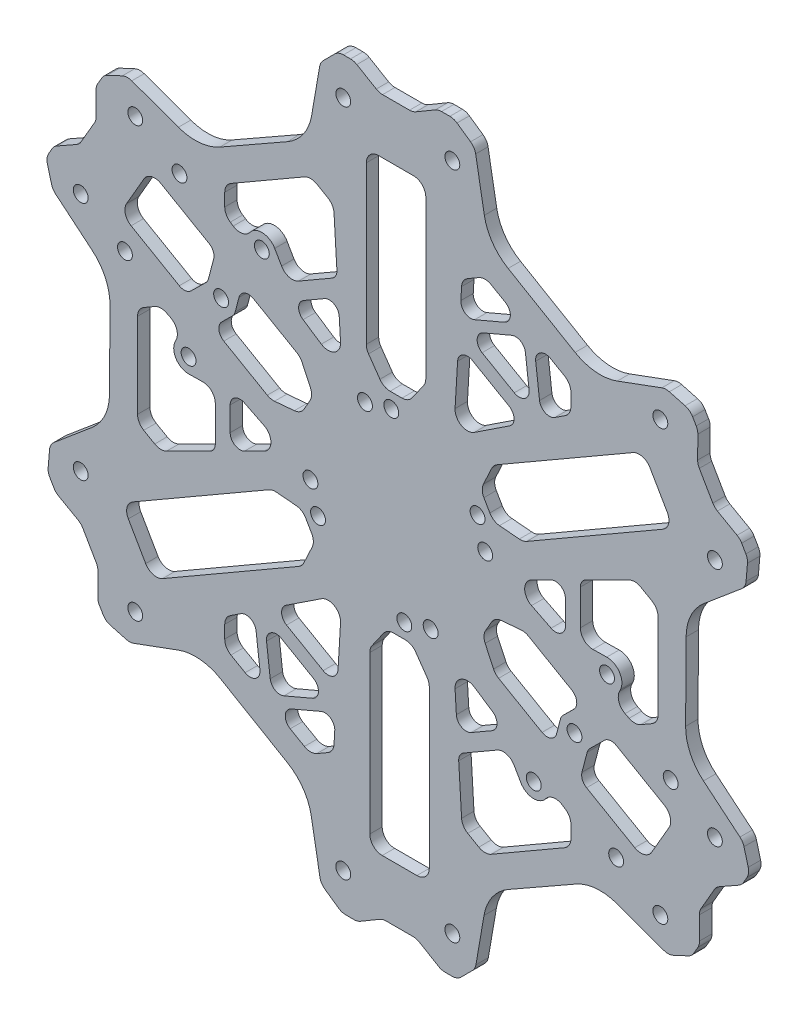
from build123d import *
from OCP.BRepFilletAPI import BRepFilletAPI_MakeChamfer

# Parameters (mm, degrees)
BOSS_EXTRUDE1_DEPTH      = 2.5
FILLET2_R                = 10
CHAMFER1_SIZE            = 3
CHAMFER1_SIZE2           = 3.705314063714124
CHAMFER1_SIZE2_2         = 3.6784582110804016
CHAMFER1_SIZE2_3         = 3.7053140637145114
CHAMFER1_SIZE2_4         = 3.6784582110804007
CHAMFER1_SIZE2_5         = 3.678458211080398
CHAMFER1_SIZE2_6         = 3.7053140637145163
CHAMFER1_SIZE2_7         = 3.678458211080397
CHAMFER1_SIZE2_8         = 3.7053140637145203
CHAMFER1_SIZE2_9         = 3.7053140637145243
CHAMFER1_SIZE2_10        = 3.6784582110807733
CUT_EXTRUDE2_DEPTH       = 2.5
CIRPATTERN1_COUNT        = 6
CUT_EXTRUDE3_DEPTH       = 9.500000000000002
FILLET4_R                = 2.5
CIRPATTERN2_COUNT        = 6
FILLET4_OF_CIRPATTERN2_R = 2.5
CUT_EXTRUDE4_DEPTH       = 9.500000000000002
CIRPATTERN3_COUNT        = 6
FILLET5_R                = 2.5
CUT_EXTRUDE5_DEPTH       = 10
FILLET6_R                = 2.5
CIRPATTERN4_COUNT        = 6
FILLET6_OF_CIRPATTERN4_R = 2.5
BOSS_EXTRUDE2_DEPTH      = 2.5
FILLET7_R                = 2
FILLET8_R                = 2
BOSS_EXTRUDE3_DEPTH      = 2.5
FILLET9_R                = 2
BOSS_EXTRUDE5_DEPTH      = 2.5
FILLET11_R               = 2
CUT_EXTRUDE6_DEPTH       = 2.5
FILLET12_R               = 2
CIRPATTERN8_COUNT        = 2
CIRPATTERN8_ANGLE        = 60.00000000000014
BOSS_EXTRUDE6_DEPTH      = 2.5
FILLET13_R               = 2
SKETCH14_R               = 1.5000000000000042
CUT_EXTRUDE7_DEPTH       = 2.5
BOSS_EXTRUDE7_DEPTH      = 2.5
FILLET14_R               = 2
FILLET15_R               = 2
SKETCH16_R               = 1.5000000000000042
CUT_EXTRUDE8_DEPTH       = 2.5
FILLET16_R               = 2
FILLET17_R               = 2
BOSS_EXTRUDE8_START      = -2.5
BOSS_EXTRUDE8_OUTLINE_R  = 1.5
BOSS_EXTRUDE8_DEPTH      = 2.5
FILLET18_R               = 2.5
FILLET19_R               = 2.5
SKETCH18_R               = 1.4999999999999958
SKETCH18_R_2             = 1.5000000000000007
SKETCH18_R_3             = 1.5000000000000042
SKETCH18_R_4             = 1.5000000000000009
CUT_EXTRUDE9_DEPTH       = 10.500000000000002


with BuildPart() as part:
    # Sketch1 → Boss-Extrude1 (new body)
    with BuildSketch(Plane.XY):
        Polygon((15.000000000000654, 75.0000000000022), (-15, 75), (-18.188921512053522, 56.503692810403834), (-39.91361886639036, 44.132859173883205), (-57.451905283832424, 50.490381056766886), (-72.45190528383297, 24.509618943233235), (-58.0280941374637, 12.499778308317667), (-58.176986619414194, -12.499778308326903), (-72.45190528382821, -24.509618943237626), (-57.45190528383172, -50.49038105676858), (-39.839172625403684, -44.00391450208413), (-18.26336775301738, -56.632637482208075), (-14.99999999998908, -75.0000000000026), (15.000000000004292, -75.00000000000004), (18.188921512066422, -56.50369281039981), (39.91361886640323, -44.132859173879176), (57.45190528384555, -50.490381056763), (72.451905283835, -24.50961894322983), (58.02809413747655, -12.499778308313674), (58.176986619427055, 12.4997783083309), (72.45190528384109, 24.50961894324161), (57.45190528383191, 50.49038105676833), (39.83917262541656, 44.00391450208814), (18.26336775303026, 56.63263748221209), align=None)
    extrude(amount=BOSS_EXTRUDE1_DEPTH)

    # Fillet2
    fillet2_edges = [part.edges().sort_by_distance(p)[0] for p in [
        (18.26336775303026, 56.63263748221209, 1.25),
        (39.83917262541656, 44.00391450208814, 1.25),
        (58.176986619427055, 12.4997783083309, 1.25),
        (58.02809413747655, -12.499778308313676, 1.25),
        (39.91361886640323, -44.132859173879176, 1.25),
        (18.188921512066422, -56.50369281039981, 1.25),
        (-18.26336775301738, -56.632637482208075, 1.25),
        (-39.839172625403684, -44.00391450208413, 1.25),
        (-58.176986619414194, -12.499778308326903, 1.25),
        (-58.0280941374637, 12.499778308317666, 1.25),
        (-39.91361886639036, 44.132859173883205, 1.25),
        (-18.188921512053522, 56.503692810403834, 1.25),
    ]]
    fillet(fillet2_edges, radius=FILLET2_R)

    # Chamfer1: one chamfer whose edges measure the first distance from different faces: ONE call of the kernel's chamfer builder (chamfer() names one face for all edges)
    chamfer1_edges_1 = [part.edges().sort_by_distance(p)[0] for p in [
        (15.000000000001307, 75.0000000000044, 1.25),
    ]]
    chamfer1_side_1 = [part.faces().sort_by_distance(p)[0] for p in [
        (16.22768101949323, 68.09018656562225, 1.25),
    ]]
    chamfer1_edges_2 = [part.edges().sort_by_distance(p)[0] for p in [
        (57.451905283833156, 50.49038105677075, 1.25),
    ]]
    chamfer1_side_2 = [part.faces().sort_by_distance(p)[0] for p in [
        (64.95190528383151, 37.500000000002466, 1.25),
    ]]
    chamfer1_edges_3 = [part.edges().sort_by_distance(p)[0] for p in [
        (72.45190528383667, 24.50961894323811, 1.25),
    ]]
    chamfer1_side_3 = [part.faces().sort_by_distance(p)[0] for p in [
        (67.0816718239975, 19.99150927542486, 1.25),
    ]]
    chamfer1_edges_4 = [part.edges().sort_by_distance(p)[0] for p in [
        (72.45190528383792, -24.50961894322733, 1.25),
    ]]
    chamfer1_side_4 = [part.faces().sort_by_distance(p)[0] for p in [
        (64.95190528383648, -37.49999999999385, 1.25),
    ]]
    chamfer1_edges_5 = [part.edges().sort_by_distance(p)[0] for p in [
        (57.45190528384011, -50.49038105676328, 1.25),
    ]]
    chamfer1_side_5 = [part.faces().sort_by_distance(p)[0] for p in [
        (50.853990804510666, -48.09867729019373, 1.25),
    ]]
    chamfer1_edges_6 = [part.edges().sort_by_distance(p)[0] for p in [
        (15.00000000000858, -74.99999999999802, 1.25),
    ]]
    chamfer1_side_6 = [part.faces().sort_by_distance(p)[0] for p in [
        (7.93021e-12, -75.00000000000004, 1.25),
    ]]
    chamfer1_edges_7 = [part.edges().sort_by_distance(p)[0] for p in [
        (-14.99999999999272, -75.00000000000132, 1.25),
    ]]
    chamfer1_side_7 = [part.faces().sort_by_distance(p)[0] for p in [
        (-16.227681019480332, -68.09018656561831, 1.25),
    ]]
    chamfer1_edges_8 = [part.edges().sort_by_distance(p)[0] for p in [
        (-57.45190528382662, -50.49038105676887, 1.25),
    ]]
    chamfer1_side_8 = [part.faces().sort_by_distance(p)[0] for p in [
        (-64.95190528383064, -37.500000000003865, 1.25),
    ]]
    chamfer1_edges_9 = [part.edges().sort_by_distance(p)[0] for p in [
        (-72.45190528383013, -24.509618943236237, 1.25),
    ]]
    chamfer1_side_9 = [part.faces().sort_by_distance(p)[0] for p in [
        (-67.081671823987, -19.991509275422867, 1.25),
    ]]
    chamfer1_edges_10 = [part.edges().sort_by_distance(p)[0] for p in [
        (-72.45190528383048, 24.509618943231025, 1.25),
    ]]
    chamfer1_side_10 = [part.faces().sort_by_distance(p)[0] for p in [
        (-64.95190528383297, 37.49999999999983, 1.25),
    ]]
    chamfer1_edges_11 = [part.edges().sort_by_distance(p)[0] for p in [
        (-57.45190528383253, 50.49038105676695, 1.25),
    ]]
    chamfer1_side_11 = [part.faces().sort_by_distance(p)[0] for p in [
        (-50.853990804500064, 48.098677290198545, 1.25),
    ]]
    chamfer1_edges_12 = [part.edges().sort_by_distance(p)[0] for p in [
        (-15, 75, 1.25),
    ]]
    chamfer1_side_12 = [part.faces().sort_by_distance(p)[0] for p in [
        (6.5387e-13, 75.0000000000011, 1.25),
    ]]
    chamfer1 = BRepFilletAPI_MakeChamfer(part.part.solid().wrapped)
    for e in chamfer1_edges_1:
        chamfer1.Add(CHAMFER1_SIZE, CHAMFER1_SIZE2, e.wrapped, chamfer1_side_1[0].wrapped)  # the first distance lies on this face
    for e in chamfer1_edges_2:
        chamfer1.Add(CHAMFER1_SIZE, CHAMFER1_SIZE2_2, e.wrapped, chamfer1_side_2[0].wrapped)  # the first distance lies on this face
    for e in chamfer1_edges_3:
        chamfer1.Add(CHAMFER1_SIZE, CHAMFER1_SIZE2_3, e.wrapped, chamfer1_side_3[0].wrapped)  # the first distance lies on this face
    for e in chamfer1_edges_4:
        chamfer1.Add(CHAMFER1_SIZE, CHAMFER1_SIZE2_4, e.wrapped, chamfer1_side_4[0].wrapped)  # the first distance lies on this face
    for e in chamfer1_edges_5:
        chamfer1.Add(CHAMFER1_SIZE, CHAMFER1_SIZE2_3, e.wrapped, chamfer1_side_5[0].wrapped)  # the first distance lies on this face
    for e in chamfer1_edges_6:
        chamfer1.Add(CHAMFER1_SIZE, CHAMFER1_SIZE2_5, e.wrapped, chamfer1_side_6[0].wrapped)  # the first distance lies on this face
    for e in chamfer1_edges_7:
        chamfer1.Add(CHAMFER1_SIZE, CHAMFER1_SIZE2_6, e.wrapped, chamfer1_side_7[0].wrapped)  # the first distance lies on this face
    for e in chamfer1_edges_8:
        chamfer1.Add(CHAMFER1_SIZE, CHAMFER1_SIZE2_7, e.wrapped, chamfer1_side_8[0].wrapped)  # the first distance lies on this face
    for e in chamfer1_edges_9:
        chamfer1.Add(CHAMFER1_SIZE, CHAMFER1_SIZE2_8, e.wrapped, chamfer1_side_9[0].wrapped)  # the first distance lies on this face
    for e in chamfer1_edges_10:
        chamfer1.Add(CHAMFER1_SIZE, CHAMFER1_SIZE2_7, e.wrapped, chamfer1_side_10[0].wrapped)  # the first distance lies on this face
    for e in chamfer1_edges_11:
        chamfer1.Add(CHAMFER1_SIZE, CHAMFER1_SIZE2_9, e.wrapped, chamfer1_side_11[0].wrapped)  # the first distance lies on this face
    for e in chamfer1_edges_12:
        chamfer1.Add(CHAMFER1_SIZE, CHAMFER1_SIZE2_10, e.wrapped, chamfer1_side_12[0].wrapped)  # the first distance lies on this face
    add(Compound.cast(chamfer1.Shape()), mode=Mode.REPLACE)

    # Sketch2 → Cut-Extrude2 (cut)
    with BuildSketch(Plane.XY):
        with BuildLine():
            ThreePointArc((12.500000000000004, 67.5), (11.000000000000004, 69), (9.500000000000004, 67.5))
            Line((9.500000000000004, 67.5), (12.500000000000004, 67.5))
        make_face()
        with BuildLine():
            Line((12.500000000000004, 67.5), (9.500000000000004, 67.5))
            ThreePointArc((9.500000000000004, 67.5), (11.000000000000004, 66), (12.500000000000004, 67.5))
        make_face()
        with BuildLine():
            ThreePointArc((-9.5, 67.5), (-11, 69), (-12.5, 67.5))
            Line((-12.5, 67.5), (-11, 67.5))
            Line((-11, 67.5), (-9.5, 67.5))
        make_face()
        with BuildLine():
            Line((-11, 67.5), (-12.5, 67.5))
            ThreePointArc((-12.5, 67.5), (-11, 66), (-9.5, 67.5))
            Line((-9.5, 67.5), (-11, 67.5))
        make_face()
    cut_extrude2 = extrude(amount=CUT_EXTRUDE2_DEPTH, mode=Mode.SUBTRACT)

    # CirPattern1: Cut-Extrude2 ×6 about axis
    cirpattern1_axis = Axis((-7.962e-14, -2.3e-15, 0), (0, 0, 1))
    for i in range(1, CIRPATTERN1_COUNT):
        add(cut_extrude2.rotate(cirpattern1_axis, i * 360 / CIRPATTERN1_COUNT), mode=Mode.SUBTRACT)

    # Sketch4 → Cut-Extrude3 (cut)
    with BuildSketch(Plane(origin=(0, 0, 0), x_dir=(-1, 0, 0), z_dir=(0, 0, -1))):
        Polygon((-34.91025403784441, 35.107349850060594), (-11.250000000000018, 19.485571585149888), (-12.948729810778094, 47.78684177437182), (-17.589745962155636, 50.46633369868304), (-34.9102540378444, 40.46633369868304), align=None)
    cut_extrude3 = extrude(amount=-CUT_EXTRUDE3_DEPTH, mode=Mode.SUBTRACT)

    # Fillet4
    fillet4_edges = [part.edges().sort_by_distance(p)[0] for p in [
        (11.250000000000018, 19.485571585149884, 1.25),
    ]]
    fillet(fillet4_edges, radius=FILLET4_R)

    # CirPattern2: Cut-Extrude3 ×6 about axis
    cirpattern2_axis = Axis((7.66e-15, -5.97e-15, 0), (0, 0, 1))
    for i in range(1, CIRPATTERN2_COUNT):
        add(cut_extrude3.rotate(cirpattern2_axis, i * 360 / CIRPATTERN2_COUNT), mode=Mode.SUBTRACT)

    # Fillet4 of CirPattern2
    fillet4_of_cirpattern2_edges = [part.edges().sort_by_distance(p)[0] for p in [
        (-11.250000000000002, 19.48557158514988, 1.25),
        (-22.500000000000014, -3.16e-15, 1.25),
        (-11.250000000000004, -19.485571585149895, 1.25),
        (11.250000000000009, -19.485571585149902, 1.25),
        (22.500000000000032, -1.68e-15, 1.25),
    ]]
    fillet(fillet4_of_cirpattern2_edges, radius=FILLET4_OF_CIRPATTERN2_R)

    # Sketch5 → Cut-Extrude4 (cut)
    with BuildSketch(Plane(origin=(0, 0, 0), x_dir=(-1, 0, 0), z_dir=(0, 0, -1))):
        Polygon((8.85265703185725, 75), (-8.14734296814275, 75), (-3.0473429681427646, 72), (3.7526570318572663, 72), align=None)
    cut_extrude4 = extrude(amount=-CUT_EXTRUDE4_DEPTH, mode=Mode.SUBTRACT)

    # CirPattern3: Cut-Extrude4 ×6 about axis
    cirpattern3_axis = Axis((-2.68e-15, -2.54e-15, 0), (0, 0, 1))
    for i in range(1, CIRPATTERN3_COUNT):
        add(cut_extrude4.rotate(cirpattern3_axis, i * 360 / CIRPATTERN3_COUNT), mode=Mode.SUBTRACT)

    # Fillet5
    fillet5_edges = [part.edges().sort_by_distance(p)[0] for p in [
        (54.00009456393864, 49.21913852888492, 1.25),
        (70.59924825197515, 27.71851505141083, 1.25),
        (58.95190528383004, 47.89230484541825, 1.25),
        (70.15628897958496, 22.578260410057936, 1.25),
        (69.62507160037215, -22.155884434685095, 1.25),
        (59.30456231569408, -47.28148494858332, 1.25),
        (70.95190528383884, -27.10769515457649, 1.25),
        (54.6314915781665, -49.46799828652797, 1.25),
        (15.624977036436885, -71.37502296357532, 1.25),
        (-11.294685936275018, -75.00000000000004, 1.25),
        (12.000000000012172, -75.00000000000004, 1.25),
        (-15.524797401412394, -72.0462586965918, 1.25),
        (-54.00009456393825, -49.219138528885516, 1.25),
        (-70.59924825197245, -27.718515051415423, 1.25),
        (-58.951905283829646, -47.89230484541885, 1.25),
        (-70.15628897958226, -22.578260410062516, 1.25),
        (-69.62507160036638, 22.15588443469498, 1.25),
        (-59.30456231568991, 47.28148494859043, 1.25),
        (-70.95190528383307, 27.10769515458637, 1.25),
        (-54.63149157816232, 49.467998286535106, 1.25),
        (-15.624977036424776, 71.3750229635749, 1.25),
        (11.294685936288626, 75.00000000000193, 1.25),
        (-12.000000000000004, 75.00000000000021, 1.25),
        (15.52479740142561, 72.04625869659397, 1.25),
        (34.9102540378444, 40.46633369868304, 1.25),
        (17.589745962155636, 50.46633369868304, 1.25),
        (12.9487298107781, 47.78684177437182, 1.25),
        (34.91025403784441, 35.1073498500606, 1.25),
        (-17.589745962155604, 50.46633369868304, 1.25),
        (-34.91025403784438, 40.46633369868305, 1.25),
        (-34.91025403784438, 35.10734985006061, 1.25),
        (-12.948729810778074, 47.78684177437183, 1.25),
        (-52.50000000000001, 10.000000000000009, 1.25),
        (-52.500000000000014, -9.99999999999999, 1.25),
        (-47.85898384862248, -12.679491924311213, 1.25),
        (-47.85898384862248, 12.679491924311227, 1.25),
        (-34.910254037844396, -40.466333698683044, 1.25),
        (-17.58974596215563, -50.46633369868305, 1.25),
        (-12.94872981077809, -47.78684177437184, 1.25),
        (-34.9102540378444, -35.10734985006061, 1.25),
        (17.589745962155604, -50.46633369868306, 1.25),
        (34.910254037844375, -40.46633369868307, 1.25),
        (34.91025403784438, -35.10734985006063, 1.25),
        (12.94872981077807, -47.78684177437184, 1.25),
        (52.50000000000002, -10, 1.25),
        (52.50000000000002, 9.999999999999996, 1.25),
        (47.85898384862249, 12.679491924311217, 1.25),
        (47.85898384862249, -12.679491924311225, 1.25),
        (3.0473429681427646, 72, 1.25),
        (8.147342968142752, 75, 1.25),
        (-8.85265703185725, 75, 1.25),
        (-3.7526570318572654, 72, 1.25),
        (63.87750055655096, 33.36092357554449, 1.25),
        (69.02557676790428, 30.44419401624387, 1.25),
        (60.525576767904276, 45.166625880579325, 1.25),
        (60.47750055655094, 39.249896321278705, 1.25),
        (60.83015758840818, -38.639076424455546, 1.25),
        (60.87823379976149, -44.55580598375617, 1.25),
        (69.3782337997615, -29.833374119420718, 1.25),
        (64.2301575884082, -32.75010367872134, 1.25),
        (-3.047342968142779, -72, 1.25),
        (-8.147342968142766, -75, 1.25),
        (8.852657031857236, -75, 1.25),
        (3.752657031857251, -72, 1.25),
        (-63.87750055655097, -33.360923575544476, 1.25),
        (-69.02557676790427, -30.444194016243852, 1.25),
        (-60.52557676790428, -45.16662588057931, 1.25),
        (-60.47750055655096, -39.24989632127869, 1.25),
        (-60.83015758840819, 38.63907642445552, 1.25),
        (-60.878233799761524, 44.55580598375614, 1.25),
        (-69.37823379976153, 29.833374119420682, 1.25),
        (-64.2301575884082, 32.7501036787213, 1.25),
    ]]
    fillet(fillet5_edges, radius=FILLET5_R)

    # Sketch6 → Cut-Extrude5 (cut)
    with BuildSketch(Plane(origin=(0, 0, 0), x_dir=(-1, 0, 0), z_dir=(0, 0, -1))):
        Polygon((-49.606824953606406, 35.97593023543246), (-52.606824953606456, 30.779777812725857), (-17.965808802229105, 10.77977781272551), (-16.715808802229084, 12.944841322186596), (-19.295935821151218, 18.475930235432166), align=None)
        Polygon((-17.965808802229105, 10.77977781272551), (-52.60682495360646, 30.779777812725865), (-55.606824953606505, 25.583625390019254), (-25.295935821151314, 8.083625390018952), (-19.215808802229127, 8.614714303264426), align=None)
    cut_extrude5 = extrude(amount=-CUT_EXTRUDE5_DEPTH, mode=Mode.SUBTRACT)

    # Fillet6
    fillet6_edges = [part.edges().sort_by_distance(p)[0] for p in [
        (16.715808802229084, 12.944841322186596, 1.25),
        (19.215808802229127, 8.614714303264426, 1.25),
        (25.295935821151314, 8.083625390018952, 1.25),
        (55.606824953606505, 25.583625390019254, 1.25),
        (49.606824953606406, 35.97593023543246, 1.25),
        (19.295935821151218, 18.475930235432166, 1.25),
    ]]
    fillet(fillet6_edges, radius=FILLET6_R)

    # CirPattern4: Cut-Extrude5 ×6 about axis
    cirpattern4_axis = Axis((1.436e-14, -2.486e-14, 0), (0, 0, 1))
    for i in range(1, CIRPATTERN4_COUNT):
        add(cut_extrude5.rotate(cirpattern4_axis, i * 360 / CIRPATTERN4_COUNT), mode=Mode.SUBTRACT)

    # Fillet6 of CirPattern4
    fillet6_of_cirpattern4_edges = [part.edges().sort_by_distance(p)[0] for p in [
        (-2.8526570318576034, 20.94873572862719, 1.25),
        (2.1473429681423974, 20.948735728627238, 1.25),
        (5.647342968142343, 25.948735728627263, 1.25),
        (5.647342968142006, 60.94873572862728, 1.25),
        (-6.352657031857991, 60.948735728627156, 1.25),
        (-6.352657031857662, 25.94873572862716, 1.25),
        (-19.568465834086673, 8.003894406440573, 1.25),
        (-17.068465834086716, 12.334021425362792, 1.25),
        (-19.648592853008957, 17.86511033860829, 1.25),
        (-49.959481985464485, 35.365110338608, 1.25),
        (-55.95948198546438, 24.972805493194684, 1.25),
        (-25.648592853008868, 7.472805493194969, 1.25),
        (-16.715808802229056, -12.944841322186644, 1.25),
        (-19.2158088022291, -8.614714303264474, 1.25),
        (-25.295935821151286, -8.083625390018998, 1.25),
        (-55.60682495360648, -25.583625390019296, 1.25),
        (-49.606824953606385, -35.9759302354325, 1.25),
        (-19.295935821151193, -18.475930235432212, 1.25),
        (2.8526570318576234, -20.94873572862724, 1.25),
        (-2.1473429681423775, -20.948735728627288, 1.25),
        (-5.647342968142324, -25.94873572862731, 1.25),
        (-5.647342968142002, -60.94873572862732, 1.25),
        (6.352657031857998, -60.948735728627206, 1.25),
        (6.35265703185768, -25.94873572862721, 1.25),
        (19.568465834086705, -8.003894406440615, 1.25),
        (17.068465834086748, -12.334021425362835, 1.25),
        (19.648592853008992, -17.865110338608336, 1.25),
        (49.95948198546453, -35.36511033860804, 1.25),
        (55.95948198546442, -24.972805493194716, 1.25),
        (25.6485928530089, -7.472805493195013, 1.25),
    ]]
    fillet(fillet6_of_cirpattern4_edges, radius=FILLET6_OF_CIRPATTERN4_R)

    # Sketch8 → Boss-Extrude2 (add)
    with BuildSketch(Plane(origin=(0, 0, 0), x_dir=(-1, 0, 0), z_dir=(0, 0, -1))):
        Polygon((-18.75000000000003, 32.475952641916464), (-20.250000000000036, 35.074028853269795), (-26.961696879329438, 31.199028853269784), (-27.111215932167767, 29.95800344948535), (-25.24519052838331, 28.725952641916464), align=None)
        Polygon((-13.538303120670637, 38.949028853269795), (-20.250000000000036, 35.074028853269795), (-18.75000000000003, 32.475952641916464), (-12.254809471616733, 36.225952641916464), (-12.388784067832296, 38.45800344948536), align=None)
        Polygon((-26.961696879329438, 31.199028853269784), (-28.044228634059984, 30.574028853269784), (-27.111215932167763, 29.95800344948535), align=None)
        Polygon((-12.388784067832296, 38.45800344948536), (-12.455771365940077, 39.5740288532698), (-13.538303120670637, 38.949028853269795), align=None)
        Polygon((-28.044228634059984, 30.574028853269784), (-26.250000000000014, 45.46633369868302), (-12.455771365940079, 39.5740288532698), (-12.522758664047858, 40.690054257054236), (-27.08333333333335, 46.90970937165709), (-28.977241335952208, 31.19005425705423), align=None)
        Polygon((-12.455771365940079, 39.5740288532698), (-26.250000000000014, 45.46633369868302), (-25.416666666666686, 44.02295802570897), (-13.538303120670628, 38.949028853269795), align=None)
        Polygon((-25.416666666666686, 44.02295802570897), (-26.250000000000014, 45.46633369868302), (-28.044228634059984, 30.574028853269784), (-26.961696879329438, 31.199028853269784), align=None)
    extrude(amount=-BOSS_EXTRUDE2_DEPTH)

    # Fillet7
    fillet7_edges = [part.edges().sort_by_distance(p)[0] for p in [
        (25.16746824526949, 46.09133369868303, 1.25),
        (28.977241335952208, 31.19005425705423, 1.25),
        (25.416666666666686, 44.02295802570897, 1.25),
        (26.961696879329438, 31.19902885326978, 1.25),
        (12.522758664047856, 40.690054257054236, 1.25),
        (27.332531754730567, 44.84133369868303, 1.25),
        (13.538303120670633, 38.949028853269795, 1.25),
    ]]
    fillet(fillet7_edges, radius=FILLET7_R)

    # Fillet8
    fillet8_edges = [part.edges().sort_by_distance(p)[0] for p in [
        (12.254809471616733, 36.225952641916464, 1.25),
        (25.24519052838331, 28.725952641916464, 1.25),
    ]]
    fillet(fillet8_edges, radius=FILLET8_R)

    # Sketch9 → Boss-Extrude3 (add)
    with BuildSketch(Plane(origin=(0, 0, 0), x_dir=(-1, 0, 0), z_dir=(0, 0, -1))):
        Polygon((13.538303120670639, -38.94902885326981), (20.25000000000004, -35.07402885326981), (18.75000000000004, -32.47595264191649), (12.254809471616733, -36.2259526419165), (12.388784067832296, -38.45800344948537), align=None)
        Polygon((18.75000000000004, -32.47595264191649), (20.250000000000043, -35.07402885326981), (26.961696879329452, -31.199028853269798), (27.111215932167784, -29.958003449485364), (25.245190528383326, -28.725952641916475), align=None)
        Polygon((12.388784067832296, -38.45800344948537), (12.455771365940077, -39.574028853269816), (13.538303120670639, -38.94902885326981), align=None)
        Polygon((28.044228634060005, -30.574028853269795), (26.250000000000014, -45.46633369868302), (12.455771365940079, -39.574028853269816), (12.522758664047858, -40.69005425705426), (27.083333333333343, -46.90970937165709), (28.97724133595222, -31.19005425705424), align=None)
        Polygon((12.455771365940079, -39.574028853269816), (26.250000000000014, -45.46633369868302), (25.416666666666686, -44.02295802570897), (13.538303120670639, -38.94902885326981), align=None)
        Polygon((25.416666666666686, -44.02295802570897), (26.250000000000014, -45.46633369868302), (28.044228634060005, -30.574028853269795), (26.961696879329452, -31.199028853269798), align=None)
        Polygon((26.961696879329452, -31.199028853269798), (28.044228634060005, -30.574028853269795), (27.11121593216778, -29.95800344948536), align=None)
    extrude(amount=-BOSS_EXTRUDE3_DEPTH)

    # Fillet9
    fillet9_edges = [part.edges().sort_by_distance(p)[0] for p in [
        (-27.33253175473056, -44.84133369868306, 1.25),
        (-28.977241335952215, -31.19005425705424, 1.25),
        (-12.254809471616735, -36.2259526419165, 1.25),
        (-25.245190528383322, -28.725952641916486, 1.25),
        (-25.416666666666686, -44.02295802570897, 1.25),
        (-26.961696879329452, -31.199028853269795, 1.25),
        (-13.538303120670639, -38.94902885326981, 1.25),
        (-25.167468245269486, -46.091333698683044, 1.25),
    ]]
    fillet(fillet9_edges, radius=FILLET9_R)

    # Sketch10 → Boss-Extrude5 (add)
    with BuildSketch(Plane(origin=(0, 0, 0), x_dir=(-1, 0, 0), z_dir=(0, 0, -1))):
        Polygon((-33.814000395174794, -9.504e-14), (-33.814000395174794, 2.5675666915968423), (-36.321554050438905, 6.9107770252193355), (-36.81400039517484, 7.1570001975872986), (-36.814000395174816, -9.592e-14), align=None)
        Polygon((-33.814000395174794, 2.5675666915968423), (-33.814000395174794, 5.657000197587287), (-36.321554050438905, 6.9107770252193355), align=None)
        Polygon((-36.814000395174794, -7.157000197587489), (-33.81400039517479, -5.657000197587476), (-33.814000395174794, -9.504e-14), (-36.814000395174816, -9.628e-14), align=None)
    boss_extrude5 = extrude(amount=-BOSS_EXTRUDE5_DEPTH)

    # Fillet11
    fillet11_edges = [part.edges().sort_by_distance(p)[0] for p in [
        (36.814000395174794, -7.1570001975874895, 1.25),
        (36.81400039517484, 7.157000197587298, 1.25),
        (33.814000395174794, 5.657000197587287, 1.25),
        (33.81400039517479, -5.657000197587476, 1.25),
    ]]
    fillet(fillet11_edges, radius=FILLET11_R)

    # Sketch11 → Cut-Extrude6 (cut)
    with BuildSketch(Plane(origin=(0, 0, 0), x_dir=(-1, 0, 0), z_dir=(0, 0, -1))):
        with BuildLine():
            ThreePointArc((-16.124355652982146, 2.5262794416288212), (-16.175466913548544, 2.914508009282599), (-16.325317547305485, 3.276279441628815))
            Line((-16.325317547305488, 3.2762794416288212), (-17.624355652982146, 2.5262794416288212))
            Line((-17.624355652982143, 2.526279441628823), (-16.87435565298214, 1.2272413359521543))
            ThreePointArc((-16.87435565298215, 1.2272413359521608), (-16.325317547305488, 1.776279441628819), (-16.124355652982146, 2.526279441628821))
        make_face()
        with BuildLine():
            Line((-17.624355652982146, 2.5262794416288212), (-16.325317547305488, 3.2762794416288212))
            ThreePointArc((-16.325317547305485, 3.276279441628815), (-19.07324439241575, 2.914508009282608), (-16.87435565298215, 1.2272413359521608))
            Line((-16.87435565298214, 1.2272413359521543), (-17.624355652982143, 2.526279441628823))
        make_face()
        with BuildLine():
            ThreePointArc((8.124355652982135, 16.526279441628823), (6.236127085328359, 17.975168181062426), (5.325317547305474, 15.77627944162883))
            Line((5.325317547305481, 15.776279441628827), (6.6243556529821355, 16.526279441628823))
            Line((6.6243556529821355, 16.526279441628823), (7.3743556529821355, 15.227241335952165))
            ThreePointArc((7.374355652982129, 15.227241335952161), (7.923393758658792, 15.77627944162882), (8.124355652982135, 16.526279441628823))
        make_face()
        with BuildLine():
            Line((6.6243556529821355, 16.526279441628823), (5.325317547305481, 15.776279441628827))
            ThreePointArc((5.325317547305474, 15.77627944162883), (6.236127085328348, 15.077390702195222), (7.374355652982129, 15.227241335952161))
            Line((7.3743556529821355, 15.227241335952165), (6.6243556529821355, 16.526279441628823))
        make_face()
        with BuildLine():
            ThreePointArc((-5.124355652982137, -16.52627944162883), (-5.175466913548534, -16.138050873975054), (-5.325317547305476, -15.776279441628837))
            Line((-5.32531754730548, -15.77627944162883), (-6.624355652982138, -16.52627944162883))
            Line((-6.624355652982138, -16.52627944162883), (-7.374355652982138, -15.227241335952172))
            ThreePointArc((-7.374355652982133, -15.227241335952169), (-7.374355652982143, -17.825317547305488), (-5.124355652982137, -16.52627944162883))
        make_face()
        with BuildLine():
            Line((-6.624355652982138, -16.52627944162883), (-5.32531754730548, -15.77627944162883))
            ThreePointArc((-5.325317547305476, -15.776279441628837), (-6.2361270853283495, -15.07739070219523), (-7.374355652982133, -15.227241335952169))
            Line((-7.374355652982138, -15.227241335952172), (-6.624355652982138, -16.52627944162883))
        make_face()
        with BuildLine():
            ThreePointArc((16.874355652982146, -1.2272413359521621), (16.17546691354854, -2.138050873975036), (16.32531754730548, -3.2762794416288177))
            Line((16.32531754730548, -3.276279441628825), (17.624355652982143, -2.5262794416288212))
            Line((17.624355652982143, -2.526279441628823), (16.874355652982143, -1.2272413359521634))
        make_face()
        with BuildLine():
            Line((17.624355652982143, -2.5262794416288212), (16.32531754730548, -3.276279441628825))
            ThreePointArc((16.32531754730548, -3.2762794416288177), (18.012584220635922, -3.975168181062427), (19.124355652982143, -2.5262794416288235))
            ThreePointArc((19.124355652982143, -2.526279441628823), (18.374355652982146, -1.2272413359521657), (16.874355652982146, -1.2272413359521621))
            Line((16.874355652982143, -1.2272413359521634), (17.624355652982143, -2.526279441628823))
        make_face()
    extrude(amount=-CUT_EXTRUDE6_DEPTH, mode=Mode.SUBTRACT)

    # Mirror4: Boss-Extrude5 across plane
    add(boss_extrude5.mirror(Plane(origin=(0, 0, 0), x_dir=(0, 0, 1), z_dir=(1, 0, 0))))

    # Fillet12
    fillet12_edges = [part.edges().sort_by_distance(p)[0] for p in [
        (-36.81400039517484, 7.157000197587298, 1.25),
        (-36.814000395174794, -7.1570001975874895, 1.25),
        (-33.81400039517479, -5.657000197587476, 1.25),
        (-33.814000395174794, 5.657000197587287, 1.25),
    ]]
    fillet(fillet12_edges, radius=FILLET12_R)

    # CirPattern8: Boss-Extrude5 ×2 about axis
    cirpattern8_axis = Axis((0, 0, 0), (0, 0, -1))
    for i in range(1, CIRPATTERN8_COUNT):
        add(boss_extrude5.rotate(cirpattern8_axis, i * CIRPATTERN8_ANGLE / (CIRPATTERN8_COUNT - 1)))

    # Sketch12 → Boss-Extrude6 (add)
    with BuildSketch(Plane(origin=(0, 0, 0), x_dir=(-1, 0, 0), z_dir=(0, 0, -1))):
        Polygon((21.80610607791136, 26.455283247004996), (24.605144183587996, 28.303359458358344), (12.20885621158605, 35.46035965594559), (12.00789431726275, 32.112283444592265), align=None)
    extrude(amount=-BOSS_EXTRUDE6_DEPTH)

    # Fillet13
    fillet13_edges = [part.edges().sort_by_distance(p)[0] for p in [
        (-12.00789431726275, 32.112283444592265, 1.25),
        (-12.208856211586053, 35.46035965594559, 1.25),
        (-24.605144183587996, 28.303359458358344, 1.25),
        (-21.80610607791136, 26.455283247004996, 1.25),
    ]]
    fillet(fillet13_edges, radius=FILLET13_R)

    # Sketch14 → Cut-Extrude7 (cut)
    with BuildSketch(Plane(origin=(0, 0, 0), x_dir=(-1, 0, 0), z_dir=(0, 0, -1))):
        with Locations((-55.03977653164196, -18.668310609958976)):
            Circle(SKETCH14_R)
        with Locations((-44.039776531641955, -37.720869493216625)):
            Circle(SKETCH14_R)
    extrude(amount=-CUT_EXTRUDE7_DEPTH, mode=Mode.SUBTRACT)

    # Sketch15 → Boss-Extrude7 (add)
    with BuildSketch(Plane(origin=(0, 0, 0), x_dir=(-1, 0, 0), z_dir=(0, 0, -1))):
        with BuildLine():
            Line((-40.26785768270317, -19.8109148957878), (-38.80428979995972, -19.92412151115884))
            Line((-38.80428979995972, -19.92412151115884), (-37.13450670690747, -20.053278822273036))
            ThreePointArc((-37.134506706907466, -20.05327882227306), (-37.003373603664066, -19.545729646872648), (-36.70560057091805, -19.114297986948248))
            Line((-36.705600570918044, -19.114297986948237), (-40.06274373916473, -15.794819387456911))
            Line((-40.06274373916473, -15.794819387456915), (-42.75658488737109, -17.350109299527922))
            Line((-42.75658488737109, -17.350109299527926), (-40.26785768270317, -19.810914895787796))
        make_face()
        Polygon((-40.26785768270317, -19.810914895787796), (-38.332815057981904, -21.72424782797265), (-38.80428979995972, -19.924121511158845), align=None)
        with BuildLine():
            Line((-38.80428979995972, -19.924121511158845), (-38.332815057981904, -21.72424782797265))
            Line((-38.332815057981904, -21.724247827972654), (-36.9380120154522, -20.918957915901636))
            ThreePointArc((-36.9380120154522, -20.918957915901625), (-37.101764635064875, -20.50098697187037), (-37.134506706907466, -20.05327882227306))
            Line((-37.13450670690747, -20.053278822273036), (-38.80428979995972, -19.92412151115884))
        make_face()
        with BuildLine():
            Line((-34.339935804098864, -19.41895791590165), (-32.94513276156916, -18.613668003830632))
            Line((-32.94513276156916, -18.613668003830625), (-37.368902590958356, -14.239529475385899))
            Line((-37.368902590958356, -14.2395294753859), (-40.06274373916473, -15.794819387456915))
            Line((-40.06274373916473, -15.794819387456911), (-36.705600570918044, -19.114297986948237))
            ThreePointArc((-36.70560057091805, -19.114297986948248), (-35.447380099945754, -18.681244296943028), (-34.33993580409886, -19.418957915901657))
        make_face()
        with BuildLine():
            Line((-35.25892494951967, -21.620013665281533), (-34.06274373916479, -26.187124232870215))
            Line((-34.06274373916479, -26.187124232870218), (-31.368902590958413, -24.631834320799204))
            Line((-31.368902590958413, -24.631834320799204), (-32.94513276156916, -18.613668003830625))
            Line((-32.94513276156916, -18.613668003830632), (-34.339935804098864, -19.41895791590165))
            ThreePointArc((-34.33993580409886, -19.418957915901657), (-34.19008517034192, -19.780729348247867), (-34.13897390977552, -20.16895791590164))
            ThreePointArc((-34.13897390977552, -20.16895791590164), (-34.451524239182326, -21.085453022166867), (-35.25892494951967, -21.620013665281533))
        make_face()
        with BuildLine():
            Line((-37.64334144517313, -24.356710364479365), (-36.75658488737115, -27.742414144941225))
            Line((-36.75658488737115, -27.742414144941225), (-34.06274373916479, -26.187124232870218))
            Line((-34.06274373916479, -26.187124232870215), (-35.25892494951967, -21.620013665281533))
            ThreePointArc((-35.25892494951967, -21.620013665281533), (-35.78144224338409, -21.662176846239323), (-36.2865592745724, -21.521966857224985))
            Line((-36.2865592745724, -21.52196685722498), (-37.009597308589164, -23.03262009017505))
            Line((-37.009597308589164, -23.03262009017505), (-37.64334144517312, -24.356710364479355))
        make_face()
        with BuildLine():
            Line((-38.332815057981904, -21.72424782797265), (-37.009597308589164, -23.032620090175058))
            Line((-37.009597308589164, -23.03262009017505), (-36.2865592745724, -21.52196685722498))
            ThreePointArc((-36.2865592745724, -21.521966857224985), (-36.6579148696837, -21.269757316438096), (-36.9380120154522, -20.918957915901625))
            Line((-36.9380120154522, -20.918957915901636), (-38.332815057981904, -21.724247827972654))
        make_face()
        Polygon((-38.332815057981904, -21.72424782797265), (-37.64334144517313, -24.356710364479365), (-37.009597308589164, -23.03262009017505), align=None)
        with BuildLine():
            Line((31.36890259095824, 24.631834320799417), (32.94513276156903, 18.613668003830842))
            Line((32.94513276156902, 18.613668003830846), (34.339935804098715, 19.418957915901878))
            ThreePointArc((34.339935804098715, 19.418957915901885), (34.25477921728626, 20.746889618860767), (35.2589249495195, 21.62001366528177))
            Line((35.2589249495195, 21.62001366528177), (34.062743739164596, 26.187124232870445))
            Line((34.062743739164596, 26.187124232870445), (31.36890259095824, 24.631834320799417))
        make_face()
        with BuildLine():
            Line((34.062743739164596, 26.187124232870445), (35.2589249495195, 21.62001366528177))
            ThreePointArc((35.2589249495195, 21.62001366528177), (36.216905612734266, 21.553152608391), (36.938012015452045, 20.91895791590187))
            Line((36.93801201545204, 20.918957915901878), (38.33281505798173, 21.724247827972903))
            Line((38.33281505798173, 21.72424782797291), (36.756584887370956, 27.742414144941478))
            Line((36.756584887370956, 27.742414144941478), (34.062743739164596, 26.187124232870445))
        make_face()
        with BuildLine():
            Line((34.339935804098715, 19.418957915901878), (32.94513276156902, 18.613668003830846))
            Line((32.94513276156903, 18.613668003830842), (37.368902590958236, 14.239529475386142))
            Line((37.36890259095824, 14.23952947538615), (40.062743739164596, 15.794819387457176))
            Line((40.062743739164596, 15.794819387457176), (36.705600570917895, 19.11429798694848))
            ThreePointArc((36.7056005709179, 19.114297986948486), (35.44738009994561, 18.681244296943266), (34.339935804098715, 19.418957915901885))
        make_face()
        with BuildLine():
            ThreePointArc((37.13897390977539, 20.168957915901878), (37.02640678954179, 19.598843888585314), (36.7056005709179, 19.114297986948486))
            Line((36.705600570917895, 19.11429798694848), (40.062743739164596, 15.794819387457176))
            Line((40.062743739164596, 15.794819387457176), (42.75658488737095, 17.350109299528203))
            Line((42.75658488737095, 17.35010929952821), (38.33281505798173, 21.72424782797291))
            Line((38.33281505798173, 21.724247827972903), (36.93801201545204, 20.918957915901878))
            ThreePointArc((36.938012015452045, 20.91895791590187), (37.08786264920899, 20.557186483555654), (37.13897390977539, 20.168957915901878))
        make_face()
    extrude(amount=-BOSS_EXTRUDE7_DEPTH)

    # Fillet14
    fillet14_edges = [part.edges().sort_by_distance(p)[0] for p in [
        (36.75658488737115, -27.742414144941225, 1.25),
        (38.332815057981904, -21.72424782797265, 1.25),
        (42.75658488737109, -17.350109299527922, 1.25),
        (37.368902590958356, -14.2395294753859, 1.25),
        (32.94513276156916, -18.61366800383063, 1.25),
        (31.368902590958413, -24.631834320799204, 1.25),
    ]]
    fillet(fillet14_edges, radius=FILLET14_R)

    # Fillet15
    fillet15_edges = [part.edges().sort_by_distance(p)[0] for p in [
        (-38.33281505798173, 21.724247827972906, 1.25),
        (-42.75658488737095, 17.350109299528206, 1.25),
        (-37.36890259095824, 14.239529475386146, 1.25),
        (-32.94513276156903, 18.613668003830846, 1.25),
        (-31.36890259095824, 24.631834320799417, 1.25),
        (-36.756584887370956, 27.742414144941478, 1.25),
    ]]
    fillet(fillet15_edges, radius=FILLET15_R)

    # Sketch16 → Cut-Extrude8 (cut)
    with BuildSketch(Plane(origin=(0, 0, 0), x_dir=(-1, 0, 0), z_dir=(0, 0, -1))):
        with Locations((44.03977653164171, 37.720869493217066)):
            Circle(SKETCH16_R)
        with Locations((55.0397765316417, 18.66831060995943)):
            Circle(SKETCH16_R)
    extrude(amount=-CUT_EXTRUDE8_DEPTH, mode=Mode.SUBTRACT)

    # Fillet16
    fillet16_edges = [part.edges().sort_by_distance(p)[0] for p in [
        (-12.52275866404786, -40.69005425705426, 1.25),
    ]]
    fillet(fillet16_edges, radius=FILLET16_R)

    # Fillet17
    fillet17_edges = [part.edges().sort_by_distance(p)[0] for p in [
        (12.208856211586294, -35.46035965594551, 1.25),
        (24.605144183588195, -28.303359458358187, 1.25),
        (21.806106077911508, -26.45528324700483, 1.25),
        (12.007894317262968, -32.11228344459219, 1.25),
    ]]
    fillet(fillet17_edges, radius=FILLET17_R)

    # Boss-Extrude8: read off the stored shape, not the designer's step
    # Boss-Extrude8 outline → Boss-Extrude8 (add)
    # profile 1 of 4: a face of its own
    with BuildSketch(Plane.XY.offset(2.5).offset(BOSS_EXTRUDE8_START)):
        with BuildLine():
            ThreePointArc((-24.82604136, 34.255423604), (-27.334204288, 35.754075901), (-29.927653361, 34.408393218))
            Line((-29.927653361, 34.408393218), (-31.11893471, 32.604115955))
            Line((-31.11893471, 32.604115955), (-25.636657657, 28.984420394))
            ThreePointArc((-25.636657657, 28.984420394), (-24.594620103, 28.654342723), (-23.534677914, 28.921393447))
            Line((-23.534677914, 28.921393447), (-22.193497688, 29.695724212))
            Line((-22.193497688, 29.695724212), (-24.82604136, 34.255423604))
        make_face()
        with Locations((-27.424117571, 32.755423604)):
            Circle(BOSS_EXTRUDE8_OUTLINE_R, mode=Mode.SUBTRACT)
    # profile 2 of 4: a face of its own
    with BuildSketch(Plane.XY.offset(2.5).offset(BOSS_EXTRUDE8_START)):
        with BuildLine():
            ThreePointArc((-44.905809872, 7.941674842), (-44.724229004, 5.02553555), (-42.148150047, 3.646892309))
            Line((-42.148150047, 3.646892309), (-36.814000395, 3.738776216))
            Line((-36.814000395, 3.738776216), (-36.814000395, 5.92093222))
            ThreePointArc((-36.814000395, 5.92093222), (-37.112698778, 6.972394444), (-37.919573204, 7.709786602))
            Line((-37.919573204, 7.709786602), (-43.64625914, 10.57312957))
            Line((-43.64625914, 10.57312957), (-44.905809872, 7.941674842))
        make_face()
        with Locations((-42.19981917, 6.646447326)):
            Circle(BOSS_EXTRUDE8_OUTLINE_R, mode=Mode.SUBTRACT)
    # profile 3 of 4: a face of its own
    with BuildSketch(Plane.XY.offset(2.5).offset(BOSS_EXTRUDE8_START)):
        with BuildLine():
            ThreePointArc((24.82604136, -34.255423604), (27.334204288, -35.754075901), (29.927653361, -34.408393218))
            Line((29.927653361, -34.408393218), (31.11893471, -32.604115955))
            Line((31.11893471, -32.604115955), (25.636657657, -28.984420394))
            ThreePointArc((25.636657657, -28.984420394), (24.594620103, -28.654342723), (23.534677914, -28.921393447))
            Line((23.534677914, -28.921393447), (22.193497688, -29.695724212))
            Line((22.193497688, -29.695724212), (24.82604136, -34.255423604))
        make_face()
        with Locations((27.424117571, -32.755423604)):
            Circle(BOSS_EXTRUDE8_OUTLINE_R, mode=Mode.SUBTRACT)
    # profile 4 of 4: a face of its own
    with BuildSketch(Plane.XY.offset(2.5).offset(BOSS_EXTRUDE8_START)):
        with BuildLine():
            ThreePointArc((44.905809872, -7.941674842), (44.724229004, -5.02553555), (42.148150047, -3.646892309))
            Line((42.148150047, -3.646892309), (36.814000395, -3.738776216))
            Line((36.814000395, -3.738776216), (36.814000395, -5.92093222))
            ThreePointArc((36.814000395, -5.92093222), (37.112698778, -6.972394444), (37.919573204, -7.709786602))
            Line((37.919573204, -7.709786602), (43.64625914, -10.57312957))
            Line((43.64625914, -10.57312957), (44.905809872, -7.941674842))
        make_face()
        with Locations((42.19981917, -6.646447326)):
            Circle(BOSS_EXTRUDE8_OUTLINE_R, mode=Mode.SUBTRACT)
    extrude(amount=BOSS_EXTRUDE8_DEPTH)

    # Fillet18
    fillet18_edges = [part.edges().sort_by_distance(p)[0] for p in [
        (-22.193497688, 29.695724212, 1.25),
        (-31.11893471, 32.604115955, 1.25),
    ]]
    fillet(fillet18_edges, radius=FILLET18_R)

    # Fillet19
    fillet19_edges = [part.edges().sort_by_distance(p)[0] for p in [
        (43.64625914, -10.57312957, 1.25),
        (36.814000395, -3.738776216, 1.25),
        (31.11893471, -32.604115955, 1.25),
        (22.193497688, -29.695724212, 1.25),
        (-36.814000395, 3.738776216, 1.25),
        (-43.64625914, 10.57312957, 1.25),
    ]]
    fillet(fillet19_edges, radius=FILLET19_R)

    # Sketch18 → Cut-Extrude9 (cut)
    with BuildSketch(Plane.XY.offset(2.5)):
        with Locations((1.3151412932510438, -17.97972200504748)):
            Circle(SKETCH18_R)
        with Locations((-16.090842891870103, -8.129254272634267)):
            Circle(SKETCH18_R_2)
        with Locations((16.090842891870828, 8.129254272634181)):
            Circle(SKETCH18_R_3)
        with Locations((-1.3151412932502944, 17.979722005047396)):
            Circle(SKETCH18_R_4)
    extrude(amount=-CUT_EXTRUDE9_DEPTH, mode=Mode.SUBTRACT)


solid = part.part
